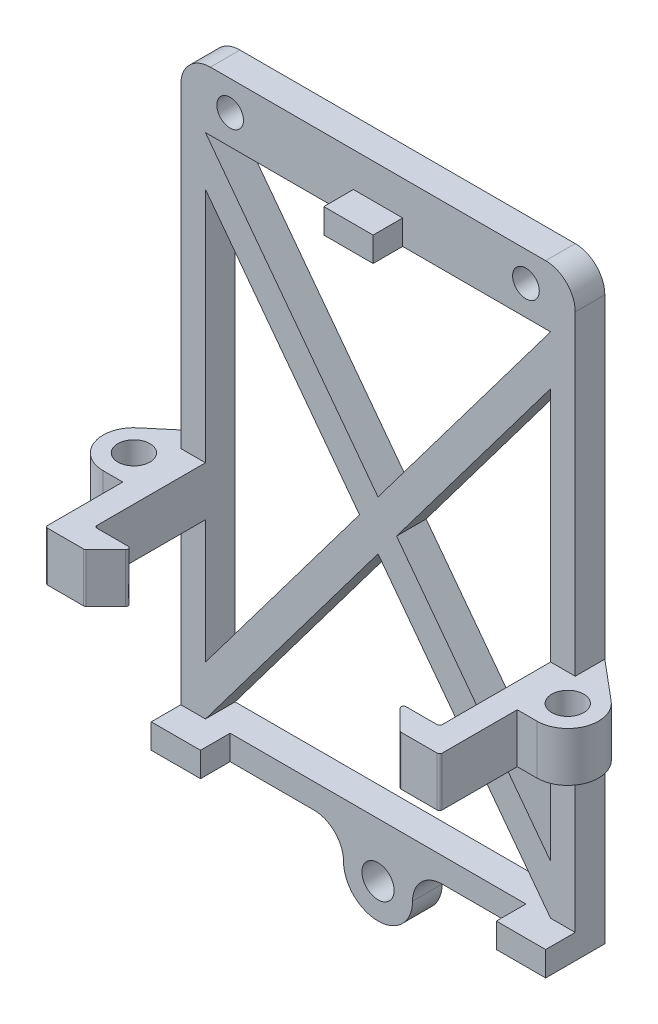
from build123d import *

# Parameters (mm, degrees)
SKETCH1_W                 = 40
SKETCH1_H                 = 60
BOSS_EXTRUDE1_DEPTH       = 3
F_2_CLEARANCE_HOLE1_D     = 2.7051
F_2_CLEARANCE_HOLE1_DEPTH = 10
F_2_CLEARANCE_HOLE1_TIP   = 0.81269403
BOSS_EXTRUDE2_START       = -20
BOSS_EXTRUDE2_DEPTH       = 5
SKETCH6_R                 = 1.625
BOSS_EXTRUDE4_DEPTH       = 5
FILLET2_R                 = 0.25
SKETCH5_W                 = 5
SKETCH5_H                 = 2.5
BOSS_EXTRUDE3_DEPTH       = 3
BOSS_EXTRUDE5_DEPTH       = 3
F_4_CLEARANCE_HOLE1_D     = 3.2639
FILLET3_START             = -1
FILLET3_DEPTH             = 4
FILLET3_2_DEPTH           = 3


with BuildPart() as part:
    # Sketch1 → Boss-Extrude1 (new body)
    with BuildSketch(Plane.XY):
        with Locations((0, 30)):
            Rectangle(SKETCH1_W, SKETCH1_H)
        Polygon((-17.5, 54), (17.5, 54), (0, 30.744655424), align=None, mode=Mode.SUBTRACT)
        Polygon((-17.5, 49.010689152), (-17.5, 7.489310848), (-1.877266096, 28.25), align=None, mode=Mode.SUBTRACT)
        Polygon((17.5, 49.010689152), (1.877266096, 28.25), (17.5, 7.489310848), align=None, mode=Mode.SUBTRACT)
        Polygon((17.5, 2.5), (-17.5, 2.5), (0, 25.755344576), align=None, mode=Mode.SUBTRACT)
    extrude(amount=BOSS_EXTRUDE1_DEPTH)

    # #2 Clearance Hole1
    with Locations(Plane.XY.offset(3)):
        with Locations((-15, 57), (15, 57)):
            Hole(F_2_CLEARANCE_HOLE1_D / 2, depth=F_2_CLEARANCE_HOLE1_DEPTH)
            with Locations((0, 0, -(F_2_CLEARANCE_HOLE1_DEPTH + F_2_CLEARANCE_HOLE1_TIP / 2))):  # 118° drill point
                Cone(0, F_2_CLEARANCE_HOLE1_D / 2, F_2_CLEARANCE_HOLE1_TIP, mode=Mode.SUBTRACT)

    # Sketch4 → Boss-Extrude2 (add)
    with BuildSketch(Plane.XZ.offset(BOSS_EXTRUDE2_START)):
        Polygon((20, 3), (20, 16.75), (16, 16.75), (13.5, 14.25), (17.5, 14.25), (17.5, 3), align=None)
    boss_extrude2 = extrude(amount=-BOSS_EXTRUDE2_DEPTH)

    # Sketch6 → Boss-Extrude4 (add)
    with BuildSketch(Plane.XZ.offset(-20)):
        with BuildLine():
            Line((20, 8.882597042), (20, 0))
            Line((20, 0), (24.00871128, 3.363708157))
            ThreePointArc((24.00871128, 3.363708157), (24.93653944, 6.826409989), (22, 8.882597042))
            Line((22, 8.882597042), (20, 8.882597042))
        make_face()
        with Locations(Location((22, 5.757597042, 0), (0, 0, 270))):
            Circle(SKETCH6_R, mode=Mode.SUBTRACT)
    boss_extrude4 = extrude(amount=-BOSS_EXTRUDE4_DEPTH)

    # Mirror1: Boss-Extrude2, Boss-Extrude4 across plane
    add(boss_extrude2.mirror(Plane(origin=(0, 0, 0), x_dir=(0, 0, 1), z_dir=(1, 0, 0))))
    add(boss_extrude4.mirror(Plane(origin=(0, 0, 0), x_dir=(0, 0, 1), z_dir=(1, 0, 0))))

    # Fillet2
    fillet2_edges = [part.edges().sort_by_distance(p)[0] for p in [
        (-20, 22.5, 16.75),
        (-16, 22.5, 16.75),
        (-13.5, 22.5, 14.25),
        (-17.5, 22.5, 14.25),
        (17.5, 22.5, 14.25),
        (13.5, 22.5, 14.25),
        (16, 22.5, 16.75),
        (20, 22.5, 16.75),
    ]]
    fillet(fillet2_edges, radius=FILLET2_R)

    # Sketch5 → Boss-Extrude3 (add)
    with BuildSketch(Plane.XY.offset(3)):
        with Locations((17.5, 1.25)):
            Rectangle(SKETCH5_W, SKETCH5_H)
        with Locations((-17.5, 1.25)):
            Rectangle(SKETCH5_W, SKETCH5_H)
        with Locations((0, 55.25)):
            Rectangle(SKETCH5_W, SKETCH5_H)
    extrude(amount=BOSS_EXTRUDE3_DEPTH)

    # Sketch7 → Boss-Extrude5 (add)
    with BuildSketch(Plane(origin=(0, 0, 0), x_dir=(-1, 0, 0), z_dir=(0, 0, -1))):
        with BuildLine():
            Line((3.5, -3), (3.5, 0))
            Line((3.5, 0), (-3.5, 0))
            Line((-3.5, 0), (-3.5, -3))
            ThreePointArc((-3.5, -3), (0, -6.5), (3.5, -3))
        make_face()
    extrude(amount=-BOSS_EXTRUDE5_DEPTH)

    # #4 Clearance Hole1 (through all)
    with Locations(Plane.XY.offset(3)):
        with Locations((0, -3)):
            Hole(F_4_CLEARANCE_HOLE1_D / 2)

    # Fillet3: read off the stored shape, not the designer's step
    # Fillet3 outline → Fillet3 (cut)
    with BuildSketch(Plane.XY.offset(FILLET3_START)):
        with BuildLine():
            Line((-20, 60), (-20, 57))
            ThreePointArc((-20, 57), (-19.121320344, 59.121320344), (-17, 60))
            Line((-17, 60), (-20, 60))
        make_face()
        with BuildLine():
            Line((20, 60), (17, 60))
            ThreePointArc((17, 60), (19.121320344, 59.121320344), (20, 57))
            Line((20, 57), (20, 60))
        make_face()
    extrude(amount=FILLET3_DEPTH, mode=Mode.SUBTRACT)

    # Fillet3 2 outline → Fillet3 2 (add)
    with BuildSketch(Plane.XY):
        with BuildLine():
            Line((-3.5, 0), (-6.5, 0))
            ThreePointArc((-6.5, 0), (-4.378679656, -0.878679656), (-3.5, -3))
            Line((-3.5, -3), (-3.5, 0))
        make_face()
        with BuildLine():
            Line((3.5, 0), (3.5, -3))
            ThreePointArc((3.5, -3), (4.378679656, -0.878679656), (6.5, 0))
            Line((6.5, 0), (3.5, 0))
        make_face()
    extrude(amount=FILLET3_2_DEPTH)


solid = part.part
